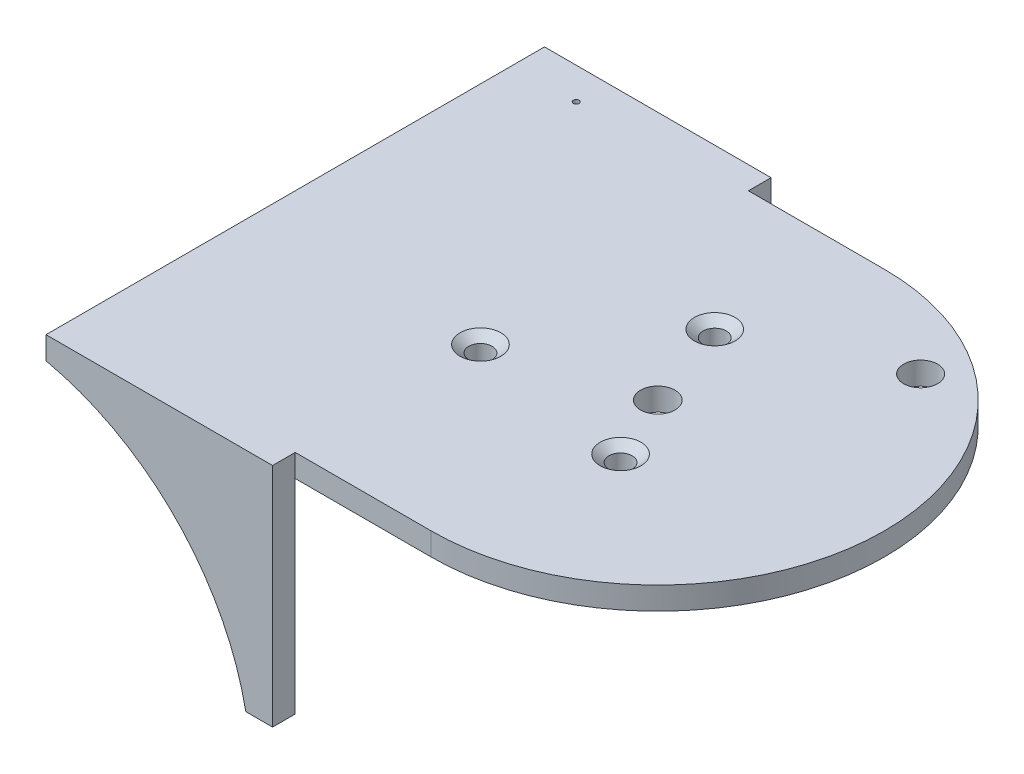
from build123d import *

# Parameters (mm, degrees)
BOSS_EXTRUDE1_DEPTH                               = 3.175
SKETCH2_R                                         = 2.413
SKETCH2_R_2                                       = 0.79375
CUT_EXTRUDE1_DEPTH                                = 60.989858518
CSK_FOR_4_FLAT_HEAD_MACHINE_SCREW_100_D           = 3.2639
CSK_FOR_4_FLAT_HEAD_MACHINE_SCREW_100_CSINK_D     = 5.715
CSK_FOR_4_FLAT_HEAD_MACHINE_SCREW_100_CSINK_ANGLE = 100
SKETCH5_R                                         = 2.38125
SKETCH5_R_2                                       = 0.396875
CUT_EXTRUDE2_DEPTH                                = 60.989858518
BOSS_EXTRUDE2_DEPTH                               = 3.175


with BuildPart() as part:
    # Sketch1 → Boss-Extrude1 (new body)
    with BuildSketch(Plane(origin=(0, 0, 0), x_dir=(1, 0, 0), z_dir=(0, 1, 0))):
        with BuildLine():
            Line((0, 31.75), (-50.8, 31.75))
            Line((-50.8, 31.75), (-50.8, -31.75))
            Line((-50.8, -31.75), (0, -31.75))
            ThreePointArc((0, -31.75), (31.75, 0), (0, 31.75))
        make_face()
    extrude(amount=BOSS_EXTRUDE1_DEPTH)

    # Sketch2 → Cut-Extrude1 (cut, through all)
    with BuildSketch(Plane(origin=(0, 3.175, 0), x_dir=(1, 0, 0), z_dir=(0, 1, 0))):
        Circle(SKETCH2_R)
        with Locations((-19.165786135, -5.680153436)):
            Circle(SKETCH2_R_2)
        with Locations((-4.607724074, 12.589841237)):
            Circle(SKETCH2_R_2)
        with Locations((3.935524409, -9.152807674)):
            Circle(SKETCH2_R_2)
    extrude(amount=-CUT_EXTRUDE1_DEPTH, mode=Mode.SUBTRACT)

    # CSK for #4 Flat Head Machine Screw (100)1 (through all)
    with Locations(Plane(origin=(0, 3.175, 0), x_dir=(1, 0, 0), z_dir=(0, 1, 0))):
        with Locations((3.935524409, -9.152807674), (-19.165786135, -5.680153436), (-4.607724074, 12.589841237)):
            CounterSinkHole(CSK_FOR_4_FLAT_HEAD_MACHINE_SCREW_100_D / 2, CSK_FOR_4_FLAT_HEAD_MACHINE_SCREW_100_CSINK_D / 2, counter_sink_angle=CSK_FOR_4_FLAT_HEAD_MACHINE_SCREW_100_CSINK_ANGLE)

    # Sketch5 → Cut-Extrude2 (cut, through all)
    with BuildSketch(Plane(origin=(0, 3.175, 0), x_dir=(1, 0, 0), z_dir=(0, 1, 0))):
        with Locations((15.24, 21.59)):
            Circle(SKETCH5_R)
        with Locations((-41.91, 30.48)):
            Circle(SKETCH5_R_2)
    extrude(amount=-CUT_EXTRUDE2_DEPTH, mode=Mode.SUBTRACT)

    # Sketch6 → Boss-Extrude2 (add)
    with BuildSketch(Plane(origin=(0, 0, -31.75), x_dir=(-1, 0, 0), z_dir=(0, 0, -1))):
        with BuildLine():
            Line((50.8, 3.175), (19.05, 3.175))
            Line((19.05, 3.175), (19.05, -28.575))
            Line((19.05, -28.575), (22.799338861, -28.575))
            ThreePointArc((22.799338861, -28.575), (32.546509941, -10.119826243), (50.8, 0))
            Line((50.8, 0), (50.8, 3.175))
        make_face()
    boss_extrude2 = extrude(amount=BOSS_EXTRUDE2_DEPTH)

    # Mirror1: Boss-Extrude2 across plane
    add(boss_extrude2.mirror(Plane.XY))


solid = part.part
